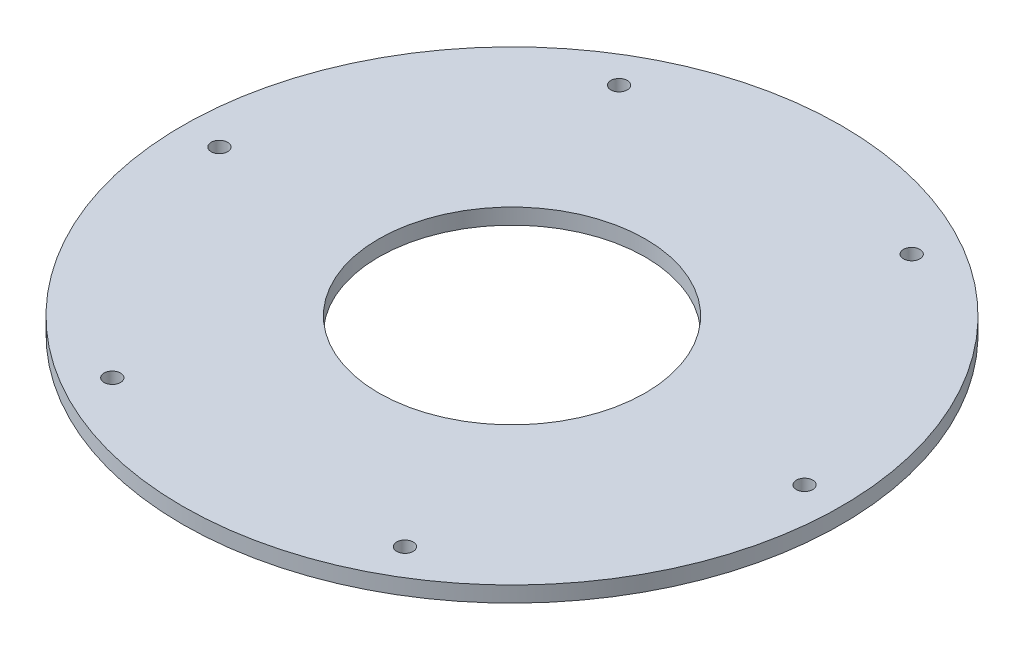
from build123d import *

# Parameters (mm, degrees)
SKETCH2_R           = 42
SKETCH2_R_2         = 1.05
SKETCH2_R_3         = 17
BOSS_EXTRUDE1_DEPTH = 2


with BuildPart() as part:
    # Sketch2 → Boss-Extrude1 (new body)
    with BuildSketch(Plane(origin=(0, 0, 0), x_dir=(1, 0, 0), z_dir=(0, 1, 0))):
        Circle(SKETCH2_R)
        with Locations((-37.2875, 0)):
            Circle(SKETCH2_R_2, mode=Mode.SUBTRACT)
        with Locations((-18.64375, 32.291922244)):
            Circle(SKETCH2_R_2, mode=Mode.SUBTRACT)
        with Locations((18.64375, 32.291922244)):
            Circle(SKETCH2_R_2, mode=Mode.SUBTRACT)
        with Locations((37.2875, 0)):
            Circle(SKETCH2_R_2, mode=Mode.SUBTRACT)
        with Locations((18.64375, -32.291922244)):
            Circle(SKETCH2_R_2, mode=Mode.SUBTRACT)
        with Locations((-18.64375, -32.291922244)):
            Circle(SKETCH2_R_2, mode=Mode.SUBTRACT)
        Circle(SKETCH2_R_3, mode=Mode.SUBTRACT)
    extrude(amount=BOSS_EXTRUDE1_DEPTH)


solid = part.part
